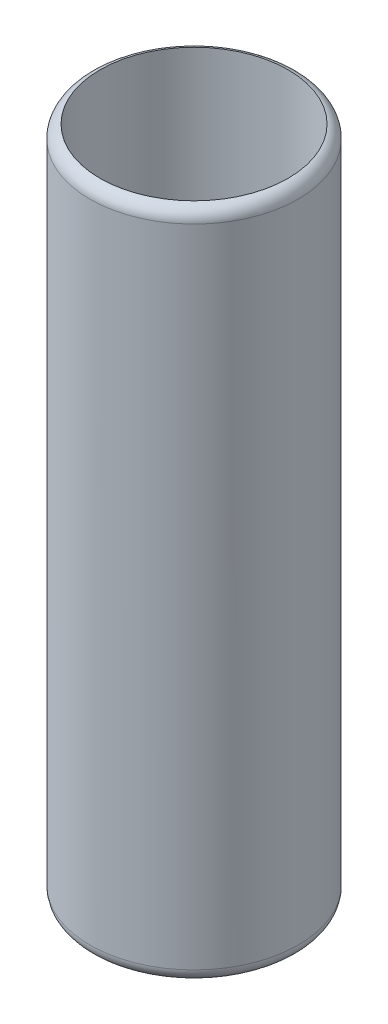
from build123d import *

# Parameters (mm, degrees)
SKETCH_1_R      = 15.5
SKETCH_1_R_2    = 14
EXTRUDE_1_DEPTH = 100
FILLET_1_R      = 2


with BuildPart() as part:
    # 草图1 → 凸台-拉伸1 (new body)
    with BuildSketch(Plane(origin=(0, 0, 0), x_dir=(1, 0, 0), z_dir=(0, 1, 0))):
        with Locations(Location((0, 0, 0), (0, 0, 270))):
            Circle(SKETCH_1_R)
        with Locations(Location((0, 0, 0), (0, 0, 270))):
            Circle(SKETCH_1_R_2, mode=Mode.SUBTRACT)
    extrude(amount=EXTRUDE_1_DEPTH)

    # 圆角1
    # the kernel refuses this fillet: 2 mm, written as the material it takes off along each edge
    with BuildSketch(Plane(origin=(0, 0, 0), x_dir=(0, 0, 1), z_dir=(-1, 0, 0))) as fillet_1_piece_1:
        with BuildLine():
            CenterArc((13.5, 1.936491673), FILLET_1_R, 284.477512186, 75.522487814)
            Line((14, 0), (14.01, -0.038729833))
            ThreePointArc((14.01, -0.038729833), (14.75, -0.04), (15.5, -0.04))
            Line((15.5, -0.04), (15.54, 0))
            Line((15.54, 0), (15.54, 1.936491673))
            Line((15.54, 1.936491673), (15.5, 1.936491673))
        make_face()
    revolve(axis=Axis((0, 0, 0), (0, 1, 0)), mode=Mode.SUBTRACT)
    with BuildSketch(Plane(origin=(0, 100, 0), x_dir=(0, 0, 1), z_dir=(-1, 0, 0))) as fillet_1_piece_2:
        with BuildLine():
            CenterArc((13.5, -1.936491673), FILLET_1_R, 0, 75.522487814)
            Line((14, 0), (14.01, 0.038729833))
            ThreePointArc((14.01, 0.038729833), (14.75, 0.04), (15.5, 0.04))
            Line((15.5, 0.04), (15.54, 0))
            Line((15.54, 0), (15.54, -1.936491673))
            Line((15.54, -1.936491673), (15.5, -1.936491673))
        make_face()
    revolve(axis=Axis((0, 100, 0), (0, 1, 0)), mode=Mode.SUBTRACT)


solid = part.part
